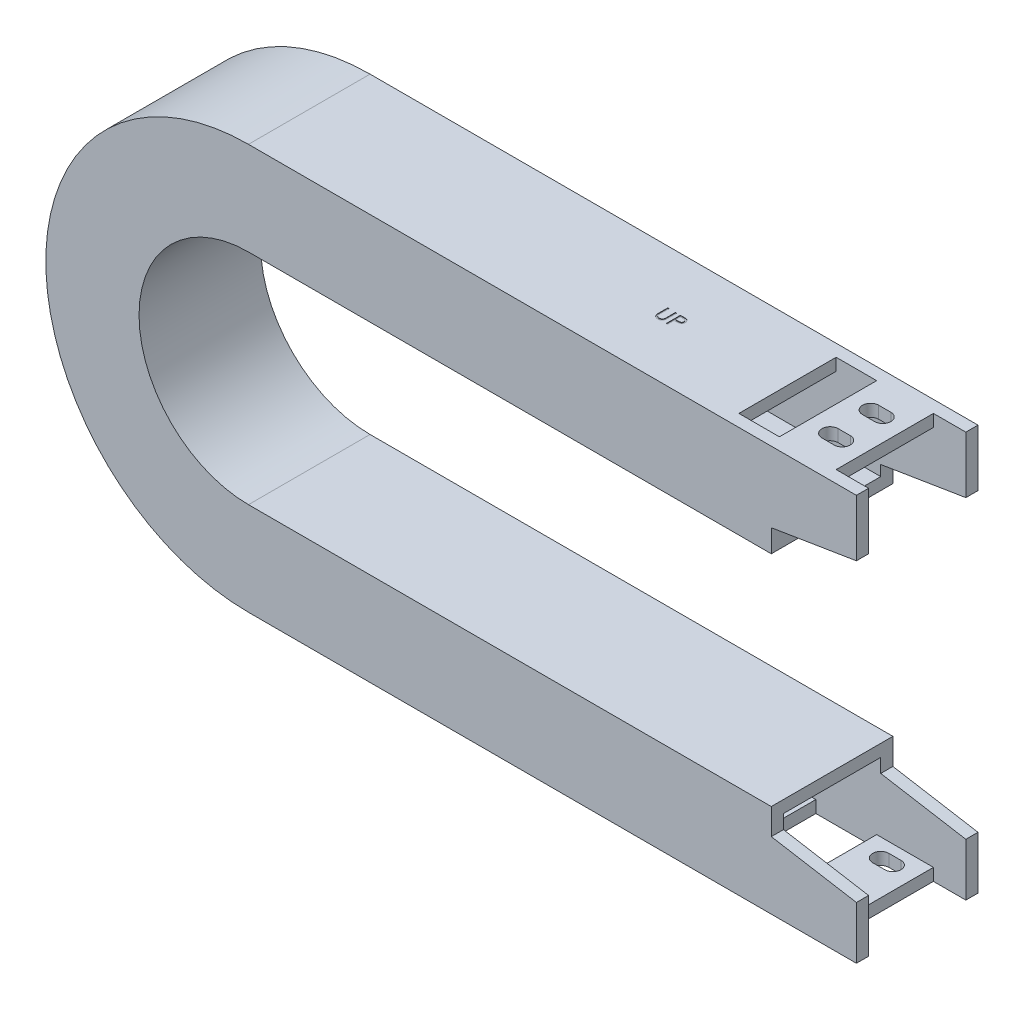
from build123d import *

# Parameters (mm, degrees)
EXTRUDE_1_DEPTH     = 30
SHELL_1_T           = -3
CUT_EXTRUDE_1_DEPTH = 226.610283454
SKETCH_3_W          = 8
SKETCH_3_H          = 24
SKETCH_3_W_2        = 15
CUT_EXTRUDE_2_DEPTH = 10
CUT_EXTRUDE_3_DEPTH = 10
CUT_EXTRUDE_4_DEPTH = 226.610283454
SKETCH_6_W          = 8
SKETCH_6_H          = 24
SKETCH_6_W_2        = 10
CUT_EXTRUDE_5_DEPTH = 225.296678531
CUT_EXTRUDE_6_DEPTH = 10
WRAP_START          = -0.1
WRAP_1_DEPTH        = 0.1


# Read off the part's stored shape, not the designer's step: 包覆1
with BuildPart() as part:
    # 草图1 → 拉伸-薄壁1 (new body)
    with BuildSketch(Plane.XY):
        with BuildLine():
            Line((0, 0), (-150, 0))
            ThreePointArc((-150, 0), (-200, 50), (-150, 100))
            Line((-150, 100), (0, 100))
            Line((0, 100), (0, 77))
            Line((0, 77), (-150, 77))
            ThreePointArc((-150, 77), (-177, 50), (-150, 23))
            Line((-150, 23), (0, 23))
            Line((0, 23), (0, 0))
        make_face()
    extrude(amount=EXTRUDE_1_DEPTH)

    # 抽壳1
    shell_1_openings = [part.faces().sort_by_distance(p)[0] for p in [
        (0, 11.5, 15),
        (0, 88.5, 15),
    ]]
    offset(amount=SHELL_1_T, openings=shell_1_openings, kind=Kind.INTERSECTION)

    # 草图2 → 切除-拉伸1 (cut, through all)
    with BuildSketch(Plane.XY.offset(30)):
        Polygon((0, 13), (-21, 16.566409365), (-21, 23), (0, 23), align=None)
    extrude(amount=-CUT_EXTRUDE_1_DEPTH, mode=Mode.SUBTRACT)

    # 草图3 → 切除-拉伸2 (cut)
    with BuildSketch(Plane(origin=(0, 3, 0), x_dir=(1, 0, 0), z_dir=(0, 1, 0))):
        with Locations((-4, -15)):
            Rectangle(SKETCH_3_W, SKETCH_3_H)
        with Locations((-29.5, -15)):
            Rectangle(SKETCH_3_W_2, SKETCH_3_H)
    extrude(amount=-CUT_EXTRUDE_2_DEPTH, mode=Mode.SUBTRACT)

    # 草图4 → 切除-拉伸3 (cut)
    with BuildSketch(Plane(origin=(0, 3, 0), x_dir=(1, 0, 0), z_dir=(0, 1, 0))):
        with BuildLine():
            Line((-16.5, -20.5), (-13.5, -20.5))
            ThreePointArc((-13.5, -20.5), (-11.5, -22.5), (-13.5, -24.5))
            Line((-13.5, -24.5), (-16.5, -24.5))
            ThreePointArc((-16.5, -24.5), (-18.5, -22.5), (-16.5, -20.5))
        make_face()
        with BuildLine():
            Line((-16.5, -9.5), (-13.5, -9.5))
            ThreePointArc((-13.5, -9.5), (-11.5, -7.5), (-13.5, -5.5))
            Line((-13.5, -5.5), (-16.5, -5.5))
            ThreePointArc((-16.5, -5.5), (-18.5, -7.5), (-16.5, -9.5))
        make_face()
    extrude(amount=-CUT_EXTRUDE_3_DEPTH, mode=Mode.SUBTRACT)

    # 草图5 → 切除-拉伸4 (cut, through all)
    with BuildSketch(Plane.XY.offset(30)):
        Polygon((0, 86), (-21, 82.582114021), (-21, 77), (0, 77), align=None)
    extrude(amount=-CUT_EXTRUDE_4_DEPTH, mode=Mode.SUBTRACT)

    # 草图6 → 切除-拉伸5 (cut, through all)
    with BuildSketch(Plane.XZ.offset(-97)):
        with Locations((-4, 15)):
            Rectangle(SKETCH_6_W, SKETCH_6_H)
        with Locations((-27, 15)):
            Rectangle(SKETCH_6_W_2, SKETCH_6_H)
    extrude(amount=-CUT_EXTRUDE_5_DEPTH, mode=Mode.SUBTRACT)

    # 草图7 → 切除-拉伸6 (cut)
    with BuildSketch(Plane.XZ.offset(-97)):
        with BuildLine():
            Line((-16.5, 22), (-13.5, 22))
            ThreePointArc((-13.5, 22), (-11.5, 20), (-13.5, 18))
            Line((-13.5, 18), (-16.5, 18))
            ThreePointArc((-16.5, 18), (-18.5, 20), (-16.5, 22))
        make_face()
        with BuildLine():
            Line((-16.5, 8), (-13.5, 8))
            ThreePointArc((-13.5, 8), (-11.5, 10), (-13.5, 12))
            Line((-13.5, 12), (-16.5, 12))
            ThreePointArc((-16.5, 12), (-18.5, 10), (-16.5, 8))
        make_face()
    extrude(amount=-CUT_EXTRUDE_6_DEPTH, mode=Mode.SUBTRACT)

    # 包覆1 outline → 包覆1 (cut)
    # profile 1 of 2: a face of its own
    with BuildSketch(Plane(origin=(0, 100, 0), x_dir=(1, 0, 0), z_dir=(0, 1, 0)).offset(WRAP_START)):
        with BuildLine():
            add(Edge.make_bspline(
                [(-63.006470007, -15.338987942), (-63.006516751, -15.368668678), (-63.006605456, -15.424992989), (-63.006012942, -15.505161289), (-63.004353574, -15.576433748), (-63.003307414, -15.639085096), (-63.000980081, -15.692827843), (-62.999082034, -15.737953154), (-62.996641477, -15.774247356), (-62.993708359, -15.795428282), (-62.992447571, -15.804532814)],
                knots=[0, 0, 0, 0, 0.191078592, 0.362604556, 0.51609875, 0.650038026, 0.765976721, 0.862374026, 0.940842058, 1, 1, 1, 1], degree=3))
            Line((-63.006470007, -15.338987942), (-63.006470007, -13.241932653))
            Line((-63.006470007, -13.241932653), (-63.320572571, -13.241932653))
            Line((-63.320572571, -13.241932653), (-63.320572571, -15.355814865))
            add(Edge.make_bspline(
                [(-63.258172732, -16.093394993), (-63.26334989, -16.074762419), (-63.274579261, -16.03434795), (-63.286604559, -15.967461461), (-63.29671364, -15.890446544), (-63.306219199, -15.803297925), (-63.311828157, -15.705948059), (-63.316745595, -15.598439143), (-63.320607214, -15.480641181), (-63.320584442, -15.398586665), (-63.320572571, -15.355814865)],
                knots=[0, 0, 0, 0, 0.078129865, 0.169465417, 0.274335291, 0.392110163, 0.52368733, 0.668365421, 0.827131902, 1, 1, 1, 1], degree=3))
            add(Edge.make_bspline(
                [(-62.164422732, -16.831676243), (-62.198091834, -16.830891478), (-62.264150493, -16.829351771), (-62.36148856, -16.820529021), (-62.454802757, -16.803910627), (-62.545078634, -16.782750683), (-62.631087131, -16.753566946), (-62.713980575, -16.719468821), (-62.792339256, -16.677591561), (-62.867434385, -16.630998168), (-62.937259141, -16.578573529), (-63.001356544, -16.521433355), (-63.059832415, -16.460492978), (-63.111701111, -16.395092612), (-63.157821996, -16.325740905), (-63.197552209, -16.252241665), (-63.231665453, -16.174623349), (-63.24927202, -16.120670149), (-63.258172732, -16.093394993)],
                knots=[0, 0, 0, 0, 0.071174504, 0.139644122, 0.206317224, 0.27137324, 0.335418084, 0.398076345, 0.460607915, 0.522969511, 0.584715724, 0.64489494, 0.704290561, 0.76299819, 0.821087431, 0.880103891, 0.939388488, 1, 1, 1, 1], degree=3))
            add(Edge.make_bspline(
                [(-61.076982828, -15.355814865), (-61.077236948, -15.393913244), (-61.077732879, -15.468264547), (-61.082033456, -15.577215906), (-61.088890456, -15.680568887), (-61.098578544, -15.778337384), (-61.111415547, -15.870171543), (-61.125690767, -15.956876311), (-61.1438703, -16.037829304), (-61.165103702, -16.113661721), (-61.18937725, -16.185847235), (-61.220818398, -16.254355849), (-61.256242898, -16.321270249), (-61.298257551, -16.385578358), (-61.345468934, -16.447564911), (-61.398920614, -16.506853986), (-61.456844775, -16.564393032), (-61.520204335, -16.618706098), (-61.58795486, -16.668514775), (-61.659894818, -16.712312546), (-61.735471587, -16.749336164), (-61.814488714, -16.779812088), (-61.896979916, -16.802726688), (-61.982947276, -16.819801843), (-62.07258647, -16.829504141), (-62.133551126, -16.830946071), (-62.164422732, -16.831676243)],
                knots=[0, 0, 0, 0, 0.054858035, 0.107058792, 0.156978355, 0.203992277, 0.248491536, 0.290483314, 0.330489004, 0.367885926, 0.403858131, 0.440009343, 0.476295011, 0.512792295, 0.550484825, 0.588381116, 0.627645327, 0.667979464, 0.708432758, 0.748602302, 0.789087777, 0.829461205, 0.870371045, 0.912214227, 0.955546575, 1, 1, 1, 1], degree=3))
            Line((-61.076982828, -15.355814865), (-61.076982828, -13.241932653))
            Line((-61.076982828, -13.241932653), (-61.391085392, -13.241932653))
            Line((-61.391085392, -13.241932653), (-61.391085392, -15.338987942))
            add(Edge.make_bspline(
                [(-61.426842603, -15.882357333), (-61.423842478, -15.870008759), (-61.41715699, -15.842491158), (-61.410909945, -15.795969868), (-61.404403419, -15.741080504), (-61.399888849, -15.677428691), (-61.395487629, -15.605227718), (-61.392854556, -15.524101461), (-61.391637523, -15.4343445), (-61.391274843, -15.371707338), (-61.391085392, -15.338987942)],
                knots=[0, 0, 0, 0, 0.069835104, 0.155620755, 0.257801557, 0.373811234, 0.506402493, 0.655564458, 0.820079282, 1, 1, 1, 1], degree=3))
            add(Edge.make_bspline(
                [(-62.181950776, -16.472701884), (-62.153397036, -16.471628034), (-62.096454474, -16.469486536), (-62.011848043, -16.456225105), (-61.929447935, -16.432324539), (-61.848847255, -16.40148478), (-61.77329627, -16.360737189), (-61.702752828, -16.31366635), (-61.639788894, -16.258455474), (-61.582330896, -16.197355129), (-61.532295961, -16.128415329), (-61.488924819, -16.053137191), (-61.453398889, -15.970387844), (-61.435855364, -15.912233422), (-61.426842603, -15.882357333)],
                knots=[0, 0, 0, 0, 0.082890648, 0.165302541, 0.247761876, 0.331527711, 0.415279813, 0.49636623, 0.577151348, 0.65778254, 0.739321642, 0.823793082, 0.909475953, 1, 1, 1, 1], degree=3))
            add(Edge.make_bspline(
                [(-62.992447571, -15.804532814), (-62.987270112, -15.837379577), (-62.977206926, -15.901222306), (-62.951560548, -15.992130588), (-62.915743047, -16.074062046), (-62.873300005, -16.149573337), (-62.817367393, -16.216562697), (-62.750363858, -16.27827435), (-62.669186089, -16.332246155), (-62.578925484, -16.381596967), (-62.481640246, -16.421262049), (-62.38222898, -16.451255413), (-62.282186001, -16.469534313), (-62.215209836, -16.471650852), (-62.181950776, -16.472701884)],
                knots=[0, 0, 0, 0, 0.086315004, 0.167766466, 0.244432684, 0.318134662, 0.391884107, 0.47006805, 0.553904179, 0.644339498, 0.736874663, 0.826168364, 0.913678595, 1, 1, 1, 1], degree=3))
        make_face()
    # profile 2 of 2: a face of its own
    with BuildSketch(Plane(origin=(0, 100, 0), x_dir=(1, 0, 0), z_dir=(0, 1, 0)).offset(WRAP_START)):
        with BuildLine():
            add(Edge.make_bspline(
                [(-59.493148693, -13.241932653), (-59.445937787, -13.24198455), (-59.355479594, -13.242083985), (-59.225764538, -13.245098731), (-59.107954807, -13.249125423), (-59.002304426, -13.254707316), (-58.908488328, -13.261303906), (-58.826931028, -13.270555946), (-58.756991472, -13.280216241), (-58.715085022, -13.290037648), (-58.695973212, -13.294516788)],
                knots=[0, 0, 0, 0, 0.176955752, 0.33905508, 0.486318225, 0.618780923, 0.735618828, 0.838742477, 0.926457068, 1, 1, 1, 1], degree=3))
            Line((-59.493148693, -13.241932653), (-60.17954693, -13.241932653))
            Line((-60.17954693, -13.241932653), (-60.17954693, -16.741932653))
            Line((-60.17954693, -16.741932653), (-59.865444366, -16.741932653))
            Line((-59.865444366, -16.741932653), (-59.865444366, -15.126548038))
            Line((-59.865444366, -15.126548038), (-59.615143885, -15.126548038))
            add(Edge.make_bspline(
                [(-58.724018084, -15.069056051), (-58.745945418, -15.073719032), (-58.794000445, -15.083938226), (-58.873143168, -15.095346683), (-58.965288554, -15.105084284), (-59.070310833, -15.112385421), (-59.188115738, -15.11863579), (-59.318766996, -15.123603883), (-59.462521073, -15.126333737), (-59.562792317, -15.12647453), (-59.615143885, -15.126548038)],
                knots=[0, 0, 0, 0, 0.075173117, 0.164746258, 0.268016881, 0.385911876, 0.517789479, 0.663690977, 0.824413221, 1, 1, 1, 1], degree=3))
            add(Edge.make_bspline(
                [(-58.025700776, -14.180734737), (-58.026122201, -14.209512513), (-58.026946747, -14.265818177), (-58.036843032, -14.348190966), (-58.050173224, -14.426909356), (-58.070670276, -14.501798806), (-58.097515949, -14.572414577), (-58.129008002, -14.639835809), (-58.166991533, -14.702915481), (-58.210636362, -14.761882598), (-58.259187957, -14.81679251), (-58.312440895, -14.867247305), (-58.370180187, -14.912951643), (-58.432222335, -14.954007987), (-58.499172184, -14.989464267), (-58.570014338, -15.021221571), (-58.645364554, -15.047892632), (-58.697507068, -15.061922694), (-58.724018084, -15.069056051)],
                knots=[0, 0, 0, 0, 0.070118894, 0.137192353, 0.202016181, 0.264631407, 0.326116547, 0.386010305, 0.445811847, 0.505297697, 0.564633278, 0.624282625, 0.683902032, 0.743952771, 0.805387731, 0.868388031, 0.933084028, 1, 1, 1, 1], degree=3))
            add(Edge.make_bspline(
                [(-58.695973212, -13.294516788), (-58.671779679, -13.301138738), (-58.623962701, -13.3142266), (-58.555061658, -13.340440323), (-58.489507813, -13.371522488), (-58.427076254, -13.406946428), (-58.368534171, -13.448231992), (-58.31300813, -13.49370561), (-58.26098815, -13.544417179), (-58.212766758, -13.599797918), (-58.16848196, -13.658918128), (-58.130352278, -13.722660358), (-58.098425051, -13.789951662), (-58.071041779, -13.860745233), (-58.051333325, -13.935635556), (-58.036486425, -14.014102269), (-58.027062797, -14.096136959), (-58.026160236, -14.152196826), (-58.025700776, -14.180734737)],
                knots=[0, 0, 0, 0, 0.062481339, 0.123490383, 0.183411094, 0.243153221, 0.302126735, 0.361709671, 0.421842292, 0.482931901, 0.544552254, 0.60568072, 0.667679738, 0.729984388, 0.794550921, 0.86034562, 0.928907356, 1, 1, 1, 1], degree=3))
        make_face()
        with BuildLine():
            add(Edge.make_bspline(
                [(-59.252663917, -14.775286019), (-59.222743992, -14.775301482), (-59.164984192, -14.775331334), (-59.081547968, -14.771346111), (-59.004138681, -14.766745578), (-58.932994106, -14.760009655), (-58.868082171, -14.750488397), (-58.809294642, -14.740876659), (-58.75708736, -14.726971297), (-58.695988158, -14.708248228), (-58.62790481, -14.676315612), (-58.553837262, -14.629965722), (-58.491066675, -14.570885014), (-58.436748379, -14.504457182), (-58.393642501, -14.430558053), (-58.362086508, -14.351489116), (-58.343545351, -14.268061267), (-58.341059157, -14.210973128), (-58.33980334, -14.18213698)],
                knots=[0, 0, 0, 0, 0.072538371, 0.140033831, 0.202495681, 0.260575056, 0.313228338, 0.361583194, 0.404878361, 0.444127437, 0.516399693, 0.586506671, 0.655085374, 0.724383783, 0.793973529, 0.861637682, 0.930110942, 1, 1, 1, 1], degree=3))
            Line((-59.252663917, -14.775286019), (-59.865444366, -14.767573679))
            Line((-59.865444366, -14.767573679), (-59.865444366, -13.600907012))
            Line((-59.865444366, -13.600907012), (-59.225320167, -13.600907012))
            add(Edge.make_bspline(
                [(-58.33980334, -14.18213698), (-58.341065987, -14.153998467), (-58.343575972, -14.098062585), (-58.362231835, -14.016083824), (-58.393581149, -13.93784812), (-58.437037743, -13.864875034), (-58.489778873, -13.79868623), (-58.551078217, -13.741189103), (-58.620791478, -13.694967401), (-58.685639709, -13.665134119), (-58.743240895, -13.646918843), (-58.793272855, -13.634174003), (-58.849763529, -13.623998397), (-58.912731309, -13.615758894), (-58.981688143, -13.608705433), (-59.057226458, -13.603919456), (-59.139060101, -13.601117999), (-59.195870672, -13.600979044), (-59.225320167, -13.600907012)],
                knots=[0, 0, 0, 0, 0.070043755, 0.139238317, 0.208197455, 0.279173374, 0.349986812, 0.418353846, 0.487609584, 0.557411073, 0.595330157, 0.637964052, 0.685912778, 0.738185165, 0.796102647, 0.858516544, 0.926657726, 1, 1, 1, 1], degree=3))
        make_face(mode=Mode.SUBTRACT)
    extrude(amount=WRAP_1_DEPTH, mode=Mode.SUBTRACT)


solid = part.part
